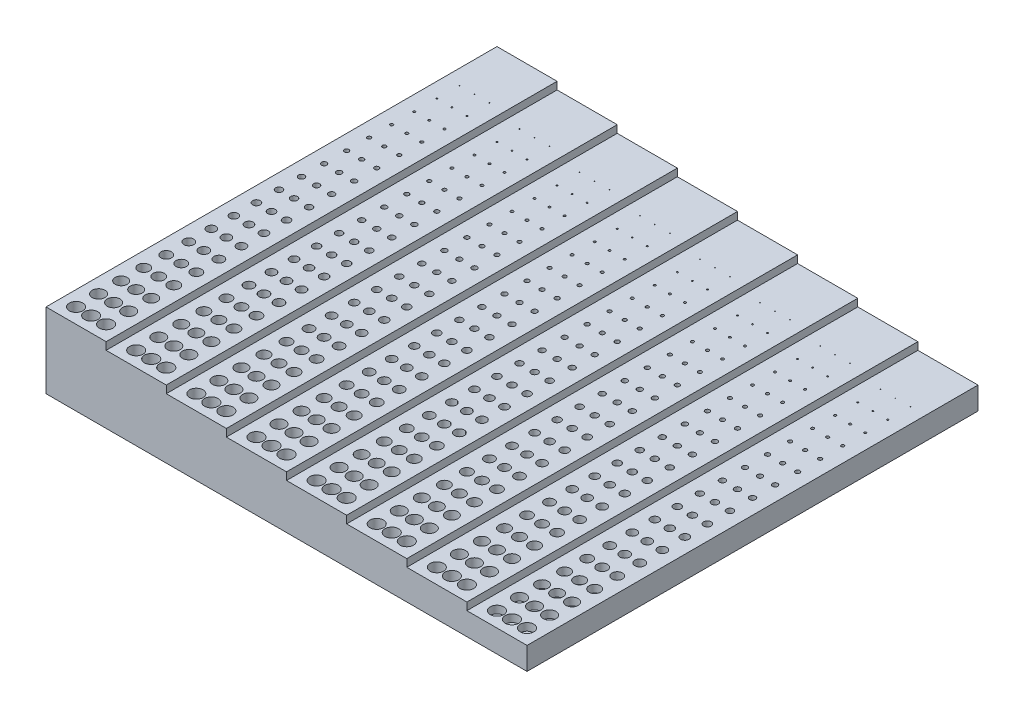
from build123d import *

# Parameters (mm, degrees)
BOSS_EXTRUDE1_DEPTH = 30
CUT_EXTRUDE1_REACH  = 46.045
SKETCH4_R           = 0.45
SKETCH4_R_2         = 0.425
SKETCH4_R_3         = 0.4
SKETCH4_R_4         = 0.375
SKETCH4_R_5         = 0.35
SKETCH4_R_6         = 0.325
SKETCH4_R_7         = 0.3
SKETCH4_R_8         = 0.275
SKETCH4_R_9         = 0.25
SKETCH4_R_10        = 0.225
SKETCH4_R_11        = 0.2
SKETCH4_R_12        = 0.175
SKETCH4_R_13        = 0.15
SKETCH4_R_14        = 0.125
SKETCH4_R_15        = 0.1
SKETCH4_R_16        = 0.075
SKETCH4_R_17        = 0.05
SKETCH4_R_18        = 0.025
LPATTERN1_COUNT     = 31
LPATTERN1_PITCH     = 1
SKETCH5_W           = 32
SKETCH5_H           = 30
BOSS_EXTRUDE2_DEPTH = 1


with BuildPart() as part:
    # Sketch3 → Boss-Extrude1 (new body)
    with BuildSketch(Plane.XY):
        Polygon((0, 0), (0, 4), (4, 4), (4, 3.5), (8, 3.5), (8, 3), (12, 3), (12, 2.5), (16, 2.5), (16, 2), (20, 2), (20, 1.5), (24, 1.5), (24, 1), (28, 1), (28, 0.5), (32, 0.5), (32, 0), align=None)
    extrude(amount=BOSS_EXTRUDE1_DEPTH)

    # Sketch4 → Cut-Extrude1 (cut, up to next)
    with BuildSketch(Plane(origin=(0, 4, 0), x_dir=(1, 0, 0), z_dir=(0, 1, 0)), mode=Mode.PRIVATE) as cut_extrude1_sk1:
        with Locations((1, -29)):
            Circle(SKETCH4_R)
    cut_extrude1_tool1 = extrude(cut_extrude1_sk1.sketch, amount=-CUT_EXTRUDE1_REACH, mode=Mode.PRIVATE) & part.part
    # Sketch4 → Cut-Extrude1 (cut, up to next)
    with BuildSketch(Plane(origin=(0, 4, 0), x_dir=(1, 0, 0), z_dir=(0, 1, 0)), mode=Mode.PRIVATE) as cut_extrude1_sk2:
        with Locations((1, -27.5)):
            Circle(SKETCH4_R_2)
    cut_extrude1_tool2 = extrude(cut_extrude1_sk2.sketch, amount=-CUT_EXTRUDE1_REACH, mode=Mode.PRIVATE) & part.part
    # Sketch4 → Cut-Extrude1 (cut, up to next)
    with BuildSketch(Plane(origin=(0, 4, 0), x_dir=(1, 0, 0), z_dir=(0, 1, 0)), mode=Mode.PRIVATE) as cut_extrude1_sk3:
        with Locations((1, -26)):
            Circle(SKETCH4_R_3)
    cut_extrude1_tool3 = extrude(cut_extrude1_sk3.sketch, amount=-CUT_EXTRUDE1_REACH, mode=Mode.PRIVATE) & part.part
    # Sketch4 → Cut-Extrude1 (cut, up to next)
    with BuildSketch(Plane(origin=(0, 4, 0), x_dir=(1, 0, 0), z_dir=(0, 1, 0)), mode=Mode.PRIVATE) as cut_extrude1_sk4:
        with Locations((1, -24.5)):
            Circle(SKETCH4_R_4)
    cut_extrude1_tool4 = extrude(cut_extrude1_sk4.sketch, amount=-CUT_EXTRUDE1_REACH, mode=Mode.PRIVATE) & part.part
    # Sketch4 → Cut-Extrude1 (cut, up to next)
    with BuildSketch(Plane(origin=(0, 4, 0), x_dir=(1, 0, 0), z_dir=(0, 1, 0)), mode=Mode.PRIVATE) as cut_extrude1_sk5:
        with Locations((1, -23)):
            Circle(SKETCH4_R_5)
    cut_extrude1_tool5 = extrude(cut_extrude1_sk5.sketch, amount=-CUT_EXTRUDE1_REACH, mode=Mode.PRIVATE) & part.part
    # Sketch4 → Cut-Extrude1 (cut, up to next)
    with BuildSketch(Plane(origin=(0, 4, 0), x_dir=(1, 0, 0), z_dir=(0, 1, 0)), mode=Mode.PRIVATE) as cut_extrude1_sk6:
        with Locations((1, -21.5)):
            Circle(SKETCH4_R_6)
    cut_extrude1_tool6 = extrude(cut_extrude1_sk6.sketch, amount=-CUT_EXTRUDE1_REACH, mode=Mode.PRIVATE) & part.part
    # Sketch4 → Cut-Extrude1 (cut, up to next)
    with BuildSketch(Plane(origin=(0, 4, 0), x_dir=(1, 0, 0), z_dir=(0, 1, 0)), mode=Mode.PRIVATE) as cut_extrude1_sk7:
        with Locations((1, -20)):
            Circle(SKETCH4_R_7)
    cut_extrude1_tool7 = extrude(cut_extrude1_sk7.sketch, amount=-CUT_EXTRUDE1_REACH, mode=Mode.PRIVATE) & part.part
    # Sketch4 → Cut-Extrude1 (cut, up to next)
    with BuildSketch(Plane(origin=(0, 4, 0), x_dir=(1, 0, 0), z_dir=(0, 1, 0)), mode=Mode.PRIVATE) as cut_extrude1_sk8:
        with Locations((1, -18.5)):
            Circle(SKETCH4_R_8)
    cut_extrude1_tool8 = extrude(cut_extrude1_sk8.sketch, amount=-CUT_EXTRUDE1_REACH, mode=Mode.PRIVATE) & part.part
    # Sketch4 → Cut-Extrude1 (cut, up to next)
    with BuildSketch(Plane(origin=(0, 4, 0), x_dir=(1, 0, 0), z_dir=(0, 1, 0)), mode=Mode.PRIVATE) as cut_extrude1_sk9:
        with Locations((1, -17)):
            Circle(SKETCH4_R_9)
    cut_extrude1_tool9 = extrude(cut_extrude1_sk9.sketch, amount=-CUT_EXTRUDE1_REACH, mode=Mode.PRIVATE) & part.part
    # Sketch4 → Cut-Extrude1 (cut, up to next)
    with BuildSketch(Plane(origin=(0, 4, 0), x_dir=(1, 0, 0), z_dir=(0, 1, 0)), mode=Mode.PRIVATE) as cut_extrude1_sk10:
        with Locations((1, -15.5)):
            Circle(SKETCH4_R_10)
    cut_extrude1_tool10 = extrude(cut_extrude1_sk10.sketch, amount=-CUT_EXTRUDE1_REACH, mode=Mode.PRIVATE) & part.part
    # Sketch4 → Cut-Extrude1 (cut, up to next)
    with BuildSketch(Plane(origin=(0, 4, 0), x_dir=(1, 0, 0), z_dir=(0, 1, 0)), mode=Mode.PRIVATE) as cut_extrude1_sk11:
        with Locations((1, -14)):
            Circle(SKETCH4_R_11)
    cut_extrude1_tool11 = extrude(cut_extrude1_sk11.sketch, amount=-CUT_EXTRUDE1_REACH, mode=Mode.PRIVATE) & part.part
    # Sketch4 → Cut-Extrude1 (cut, up to next)
    with BuildSketch(Plane(origin=(0, 4, 0), x_dir=(1, 0, 0), z_dir=(0, 1, 0)), mode=Mode.PRIVATE) as cut_extrude1_sk12:
        with Locations((1, -12.5)):
            Circle(SKETCH4_R_12)
    cut_extrude1_tool12 = extrude(cut_extrude1_sk12.sketch, amount=-CUT_EXTRUDE1_REACH, mode=Mode.PRIVATE) & part.part
    # Sketch4 → Cut-Extrude1 (cut, up to next)
    with BuildSketch(Plane(origin=(0, 4, 0), x_dir=(1, 0, 0), z_dir=(0, 1, 0)), mode=Mode.PRIVATE) as cut_extrude1_sk13:
        with Locations((1, -11)):
            Circle(SKETCH4_R_13)
    cut_extrude1_tool13 = extrude(cut_extrude1_sk13.sketch, amount=-CUT_EXTRUDE1_REACH, mode=Mode.PRIVATE) & part.part
    # Sketch4 → Cut-Extrude1 (cut, up to next)
    with BuildSketch(Plane(origin=(0, 4, 0), x_dir=(1, 0, 0), z_dir=(0, 1, 0)), mode=Mode.PRIVATE) as cut_extrude1_sk14:
        with Locations((1, -9.5)):
            Circle(SKETCH4_R_14)
    cut_extrude1_tool14 = extrude(cut_extrude1_sk14.sketch, amount=-CUT_EXTRUDE1_REACH, mode=Mode.PRIVATE) & part.part
    # Sketch4 → Cut-Extrude1 (cut, up to next)
    with BuildSketch(Plane(origin=(0, 4, 0), x_dir=(1, 0, 0), z_dir=(0, 1, 0)), mode=Mode.PRIVATE) as cut_extrude1_sk15:
        with Locations((1, -8)):
            Circle(SKETCH4_R_15)
    cut_extrude1_tool15 = extrude(cut_extrude1_sk15.sketch, amount=-CUT_EXTRUDE1_REACH, mode=Mode.PRIVATE) & part.part
    # Sketch4 → Cut-Extrude1 (cut, up to next)
    with BuildSketch(Plane(origin=(0, 4, 0), x_dir=(1, 0, 0), z_dir=(0, 1, 0)), mode=Mode.PRIVATE) as cut_extrude1_sk16:
        with Locations((1, -6.5)):
            Circle(SKETCH4_R_16)
    cut_extrude1_tool16 = extrude(cut_extrude1_sk16.sketch, amount=-CUT_EXTRUDE1_REACH, mode=Mode.PRIVATE) & part.part
    # Sketch4 → Cut-Extrude1 (cut, up to next)
    with BuildSketch(Plane(origin=(0, 4, 0), x_dir=(1, 0, 0), z_dir=(0, 1, 0)), mode=Mode.PRIVATE) as cut_extrude1_sk17:
        with Locations((1, -5)):
            Circle(SKETCH4_R_17)
    cut_extrude1_tool17 = extrude(cut_extrude1_sk17.sketch, amount=-CUT_EXTRUDE1_REACH, mode=Mode.PRIVATE) & part.part
    # Sketch4 → Cut-Extrude1 (cut, up to next)
    with BuildSketch(Plane(origin=(0, 4, 0), x_dir=(1, 0, 0), z_dir=(0, 1, 0)), mode=Mode.PRIVATE) as cut_extrude1_sk18:
        with Locations((1, -3.5)):
            Circle(SKETCH4_R_18)
    cut_extrude1_tool18 = extrude(cut_extrude1_sk18.sketch, amount=-CUT_EXTRUDE1_REACH, mode=Mode.PRIVATE) & part.part
    cut_extrude1_1 = cut_extrude1_tool1.solids().sort_by_distance((1, 4, 29))[0]
    add(cut_extrude1_1, mode=Mode.SUBTRACT)
    cut_extrude1_2 = cut_extrude1_tool2.solids().sort_by_distance((1, 4, 27.5))[0]
    add(cut_extrude1_2, mode=Mode.SUBTRACT)
    cut_extrude1_3 = cut_extrude1_tool3.solids().sort_by_distance((1, 4, 26))[0]
    add(cut_extrude1_3, mode=Mode.SUBTRACT)
    cut_extrude1_4 = cut_extrude1_tool4.solids().sort_by_distance((1, 4, 24.5))[0]
    add(cut_extrude1_4, mode=Mode.SUBTRACT)
    cut_extrude1_5 = cut_extrude1_tool5.solids().sort_by_distance((1, 4, 23))[0]
    add(cut_extrude1_5, mode=Mode.SUBTRACT)
    cut_extrude1_6 = cut_extrude1_tool6.solids().sort_by_distance((1, 4, 21.5))[0]
    add(cut_extrude1_6, mode=Mode.SUBTRACT)
    cut_extrude1_7 = cut_extrude1_tool7.solids().sort_by_distance((1, 4, 20))[0]
    add(cut_extrude1_7, mode=Mode.SUBTRACT)
    cut_extrude1_8 = cut_extrude1_tool8.solids().sort_by_distance((1, 4, 18.5))[0]
    add(cut_extrude1_8, mode=Mode.SUBTRACT)
    cut_extrude1_9 = cut_extrude1_tool9.solids().sort_by_distance((1, 4, 17))[0]
    add(cut_extrude1_9, mode=Mode.SUBTRACT)
    cut_extrude1_10 = cut_extrude1_tool10.solids().sort_by_distance((1, 4, 15.5))[0]
    add(cut_extrude1_10, mode=Mode.SUBTRACT)
    cut_extrude1_11 = cut_extrude1_tool11.solids().sort_by_distance((1, 4, 14))[0]
    add(cut_extrude1_11, mode=Mode.SUBTRACT)
    cut_extrude1_12 = cut_extrude1_tool12.solids().sort_by_distance((1, 4, 12.5))[0]
    add(cut_extrude1_12, mode=Mode.SUBTRACT)
    cut_extrude1_13 = cut_extrude1_tool13.solids().sort_by_distance((1, 4, 11))[0]
    add(cut_extrude1_13, mode=Mode.SUBTRACT)
    cut_extrude1_14 = cut_extrude1_tool14.solids().sort_by_distance((1, 4, 9.5))[0]
    add(cut_extrude1_14, mode=Mode.SUBTRACT)
    cut_extrude1_15 = cut_extrude1_tool15.solids().sort_by_distance((1, 4, 8))[0]
    add(cut_extrude1_15, mode=Mode.SUBTRACT)
    cut_extrude1_16 = cut_extrude1_tool16.solids().sort_by_distance((1, 4, 6.5))[0]
    add(cut_extrude1_16, mode=Mode.SUBTRACT)
    cut_extrude1_17 = cut_extrude1_tool17.solids().sort_by_distance((1, 4, 5))[0]
    add(cut_extrude1_17, mode=Mode.SUBTRACT)
    cut_extrude1_18 = cut_extrude1_tool18.solids().sort_by_distance((1, 4, 3.5))[0]
    add(cut_extrude1_18, mode=Mode.SUBTRACT)
    cut_extrude1 = cut_extrude1_1 + cut_extrude1_2 + cut_extrude1_3 + cut_extrude1_4 + cut_extrude1_5 + cut_extrude1_6 + cut_extrude1_7 + cut_extrude1_8 + cut_extrude1_9 + cut_extrude1_10 + cut_extrude1_11 + cut_extrude1_12 + cut_extrude1_13 + cut_extrude1_14 + cut_extrude1_15 + cut_extrude1_16 + cut_extrude1_17 + cut_extrude1_18  # Cut-Extrude1 as one shape, for the pattern or mirror that repeats it

    # LPattern1: Cut-Extrude1 ×31, 7 skipped
    with Locations(*[(i * LPATTERN1_PITCH, 0, 0) for i in range(1, LPATTERN1_COUNT) if i not in (3, 7, 11, 15, 19, 23, 27)]):
        add(cut_extrude1, mode=Mode.SUBTRACT)

    # Sketch5 → Boss-Extrude2 (add)
    with BuildSketch(Plane.XZ):
        with Locations((16, 15)):
            Rectangle(SKETCH5_W, SKETCH5_H)
    extrude(amount=BOSS_EXTRUDE2_DEPTH)


solid = part.part
